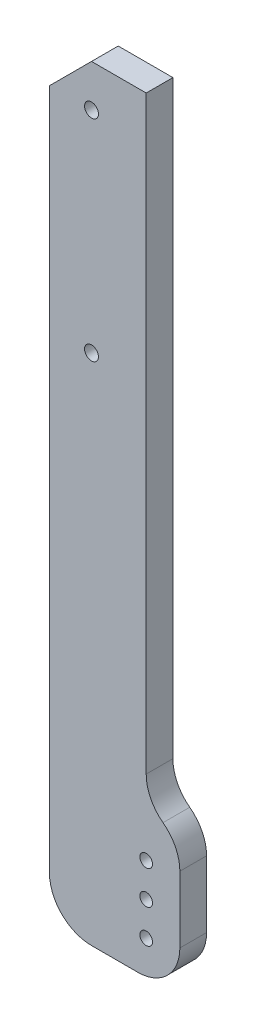
from build123d import *

# Parameters (mm, degrees)
SKETCH1_W           = 16
SKETCH1_H           = 32
SKETCH1_R           = 1.5
SKETCH1_W_2         = 8
SKETCH1_H_2         = 150
BOSS_EXTRUDE1_DEPTH = 6.35
FILLET1_R           = 10
FILLET2_R           = 10
CHAMFER1_SIZE       = 10
SKETCH2_R           = 1.65
CUT_EXTRUDE1_DEPTH  = 10


with BuildPart() as part:
    # Sketch1 → Boss-Extrude1 (new body)
    # profile 1 of 3: a face of its own
    with BuildSketch(Plane.XY):
        Rectangle(SKETCH1_W, SKETCH1_H)
        with Locations((0, -8)):
            Circle(SKETCH1_R, mode=Mode.SUBTRACT)
        with Locations((0, 8)):
            Circle(SKETCH1_R, mode=Mode.SUBTRACT)
        Circle(SKETCH1_R, mode=Mode.SUBTRACT)
    # profile 2 of 3: a face of its own
    with BuildSketch(Plane.XY):
        with Locations((-4, 91)):
            Rectangle(SKETCH1_W_2, SKETCH1_H_2)
    # profile 3 of 3: a face of its own
    with BuildSketch(Plane.XY):
        Polygon((-23, -16), (-23, 166), (-8, 166), (-8, 16), (-8, -16), align=None)
    extrude(amount=BOSS_EXTRUDE1_DEPTH)

    # Fillet1
    # the kernel refuses this fillet: 10 mm, written as the material it adds along each edge
    with BuildSketch(Plane(origin=(0, 16, 0), x_dir=(0, 1, 0), z_dir=(0, 0, 1))) as fillet1_piece_1:
        with BuildLine():
            CenterArc((9.797958971, -10), FILLET1_R, 90, 78.463040967)
            Line((0, -8), (0, 0))
            Line((0, 0), (9.797958971, 0))
        make_face()
    extrude(amount=6.35)
    # the kernel refuses this fillet: 10 mm, written as the material it takes off along each edge
    with BuildSketch(Plane(origin=(8, -16, -25), x_dir=(0, 1, 0), z_dir=(0, 0, 1)), Plane(origin=(-23, -16, -25), x_dir=(1, 0, 0), z_dir=(0, 0, 1))) as fillet1_2_piece_1:
        with BuildLine():
            CenterArc((FILLET1_R, FILLET1_R), FILLET1_R, 180, 90)
            Line((0, FILLET1_R), (0, 0))
            Line((0, 0), (FILLET1_R, 0))
        make_face()
    extrude(amount=56.35, mode=Mode.SUBTRACT)

    # Fillet2
    fillet2_edges = [part.edges().sort_by_distance(p)[0] for p in [
        (8, 16, 3.175),
    ]]
    fillet(fillet2_edges, radius=FILLET2_R)

    # Chamfer1
    chamfer1_edges = [part.edges().sort_by_distance(p)[0] for p in [
        (-23, 166, 3.175),
    ]]
    chamfer(chamfer1_edges, length=CHAMFER1_SIZE)

    # Sketch2 → Cut-Extrude1 (cut)
    with BuildSketch(Plane.XY.offset(6.35)):
        with Locations((-13, 156)):
            Circle(SKETCH2_R)
        with Locations((-13, 106)):
            Circle(SKETCH2_R)
    extrude(amount=-CUT_EXTRUDE1_DEPTH, mode=Mode.SUBTRACT)


solid = part.part
